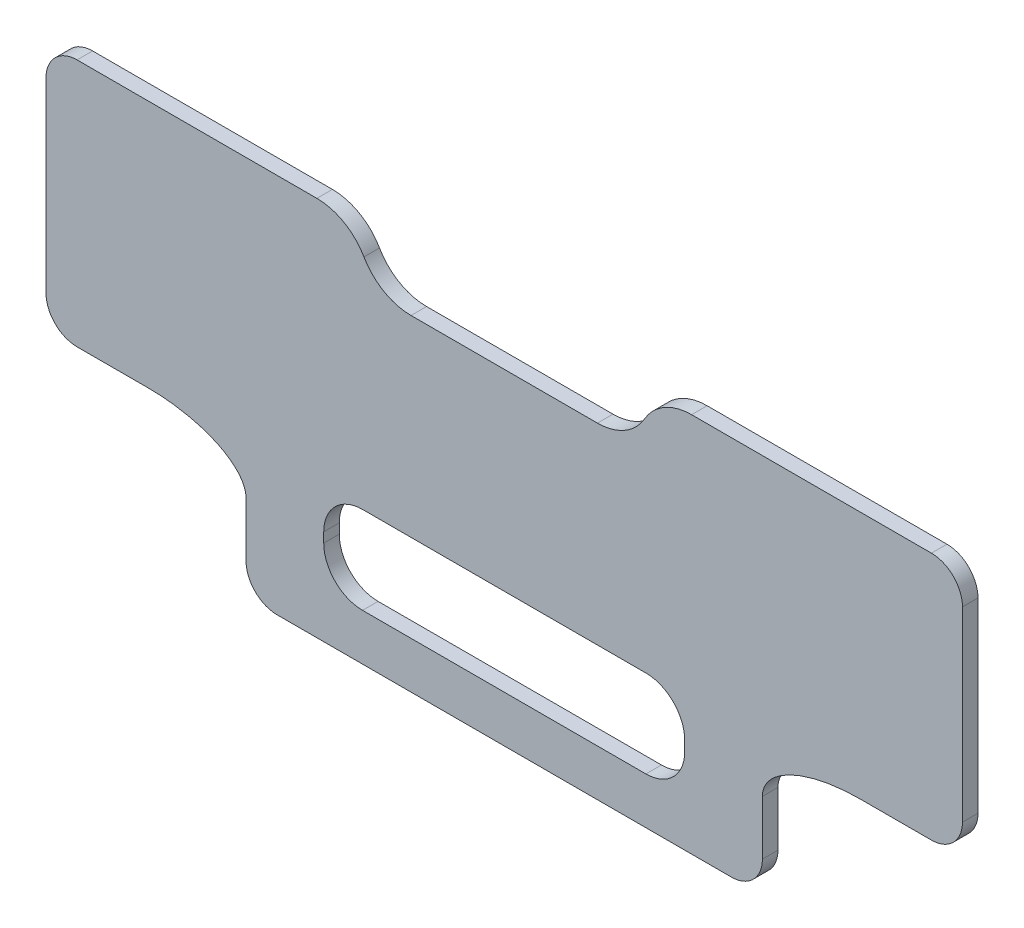
from build123d import *

# Parameters (mm, degrees)
SKETCH1_W           = 118
SKETCH1_H           = 52
BOSS_EXTRUDE1_DEPTH = 2
CUT_EXTRUDE1_DEPTH  = 10
SKETCH4_W           = 38
SKETCH4_H           = 7
CUT_EXTRUDE2_DEPTH  = 10
SKETCH5_W           = 46.483490982
SKETCH5_H           = 11.25265215
CUT_EXTRUDE3_DEPTH  = 10
FILLET1_R           = 5
FILLET2_R           = 7
FILLET3_R           = 7
FILLET4_R           = 4
FILLET5_R           = 4


with BuildPart() as part:
    # Sketch1 → Boss-Extrude1 (new body)
    with BuildSketch(Plane.XY):
        Rectangle(SKETCH1_W, SKETCH1_H)
    extrude(amount=BOSS_EXTRUDE1_DEPTH)

    # Sketch3 → Cut-Extrude1 (cut)
    with BuildSketch(Plane.XY.offset(2)):
        with BuildLine():
            Line((-33.241745491, -23), (-33.241745491, -12))
            add(Edge.make_bspline(
                [(-33.241745491, -12), (-33.241745491, -6), (-45.86936562, -6)],
                knots=[3.141592654, 3.141592654, 3.141592654, 4.71238898, 4.71238898, 4.71238898], degree=2, weights=[1, 0.707106781, 1]))
            Line((-45.86936562, -6), (-59, -6))
            Line((-59, -6), (-59, -26))
            Line((-59, -26), (59, -26))
            Line((59, -26), (59, -6))
            Line((59, -6), (45.86936562, -6))
            add(Edge.make_bspline(
                [(45.86936562, -6), (33.241745491, -6), (33.241745491, -12)],
                knots=[1.570796327, 1.570796327, 1.570796327, 3.141592654, 3.141592654, 3.141592654], degree=2, weights=[1, 0.707106781, 1]))
            Line((33.241745491, -12), (33.241745491, -23))
            Line((33.241745491, -23), (-33.241745491, -23))
        make_face()
    extrude(amount=-CUT_EXTRUDE1_DEPTH, mode=Mode.SUBTRACT)

    # Sketch4 → Cut-Extrude2 (cut)
    with BuildSketch(Plane.XY.offset(2)):
        with Locations((0, 22.5)):
            Rectangle(SKETCH4_W, SKETCH4_H)
    extrude(amount=-CUT_EXTRUDE2_DEPTH, mode=Mode.SUBTRACT)

    # Sketch5 → Cut-Extrude3 (cut)
    with BuildSketch(Plane.XY.offset(2)):
        with Locations((0, -11.373673925)):
            Rectangle(SKETCH5_W, SKETCH5_H)
    extrude(amount=-CUT_EXTRUDE3_DEPTH, mode=Mode.SUBTRACT)

    # Fillet1
    fillet1_edges = [part.edges().sort_by_distance(p)[0] for p in [
        (-23.241745491, -17, 1),
        (-23.241745491, -5.74734785, 1),
        (23.241745491, -5.74734785, 1),
        (23.241745491, -17, 1),
    ]]
    fillet(fillet1_edges, radius=FILLET1_R)

    # Fillet2
    fillet2_edges = [part.edges().sort_by_distance(p)[0] for p in [
        (19, 19, 1),
        (-19, 19, 1),
    ]]
    fillet(fillet2_edges, radius=FILLET2_R - 0.0001)  # a hair under: the kernel refuses the full size

    # Fillet3
    fillet3_edges = [part.edges().sort_by_distance(p)[0] for p in [
        (19, 26, 1),
        (-19, 26, 1),
    ]]
    fillet(fillet3_edges, radius=FILLET3_R)

    # Fillet4
    fillet4_edges = [part.edges().sort_by_distance(p)[0] for p in [
        (59, -6, 1),
        (-59, -6, 1),
        (-33.241745491, -23, 1),
        (33.241745491, -23, 1),
    ]]
    fillet(fillet4_edges, radius=FILLET4_R)

    # Fillet5
    fillet5_edges = [part.edges().sort_by_distance(p)[0] for p in [
        (-59, 26, 1),
        (59, 26, 1),
    ]]
    fillet(fillet5_edges, radius=FILLET5_R)


solid = part.part
